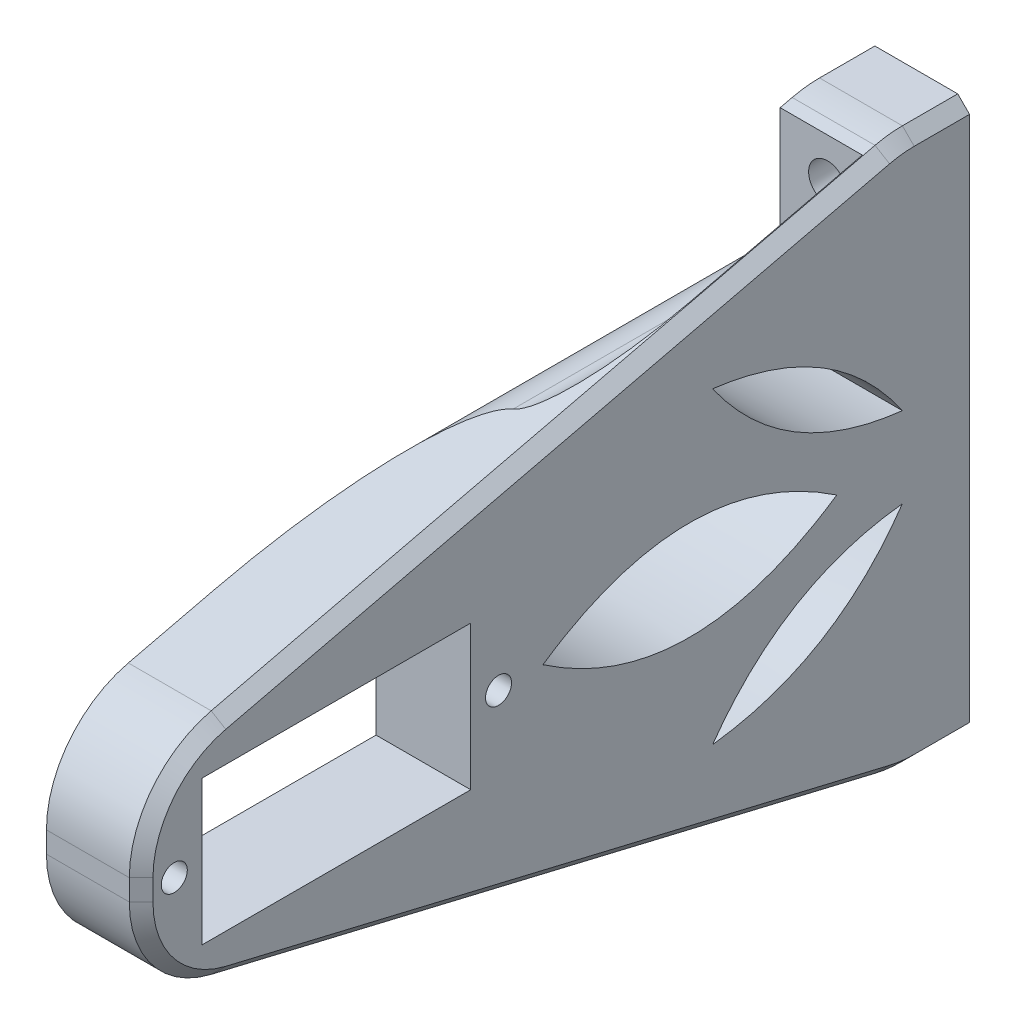
from build123d import *

# Parameters (mm, degrees)
SKETCH1_W           = 8.000974829
SKETCH1_H           = 46.5
BOSS_EXTRUDE1_DEPTH = 70
CUT_EXTRUDE1_DEPTH  = 70
SKETCH3_R           = 1.1
CUT_EXTRUDE2_DEPTH  = 70
FILLET1_R           = 9
CUT_EXTRUDE3_DEPTH  = 62
SKETCH5_R           = 1.6
CUT_EXTRUDE4_DEPTH  = 62
FILLET2_R           = 5
CHAMFER1_SIZE       = 1


with BuildPart() as part:
    # Sketch1 → Boss-Extrude1 (new body)
    with BuildSketch(Plane.XY):
        with Locations((34.458782271, 0)):
            Rectangle(SKETCH1_W, SKETCH1_H)
    extrude(amount=BOSS_EXTRUDE1_DEPTH)

    # Sketch2 → Cut-Extrude1 (cut)
    with BuildSketch(Plane(origin=(38.459269685, 0, 0), x_dir=(0, 0, -1), z_dir=(1, 0, 0))):
        with BuildLine():
            Line((0, -23.25), (-4.675968949, -23.25))
            ThreePointArc((-4.675968949, -23.25), (-5.84025075, -23.181991134), (-6.988696254, -22.978889578))
            Line((-6.988696254, -22.978889578), (-70, -8))
            Line((-70, -8), (-70, 0))
            Line((-70, 0), (-70, 8))
            Line((-70, 8), (-6.988696254, 22.978889578))
            ThreePointArc((-6.988696254, 22.978889578), (-5.84025075, 23.181991134), (-4.675968949, 23.25))
            Line((-4.675968949, 23.25), (0, 23.25))
            Line((0, 23.25), (0, 33.462731107))
            Line((0, 33.462731107), (-74.824697051, 33.462731107))
            Line((-74.824697051, 33.462731107), (-74.824697051, -41.354226456))
            Line((-74.824697051, -41.354226456), (0, -41.354226456))
            Line((0, -41.354226456), (0, -23.25))
        make_face()
        with BuildLine():
            add(Edge.make_bspline(
                [(-36.048150351, 0), (-23.713645553, -8.388071288), (-11.218940507, 0)],
                knots=[0, 0, 0, 1, 1, 1], degree=2))
            add(Edge.make_bspline(
                [(-36.048150351, 0), (-23.713645553, 8.388071288), (-11.218940507, 0)],
                knots=[0, 0, 0, 1, 1, 1], degree=2))
        make_face()
        with BuildLine():
            add(Edge.make_bspline(
                [(-5.680368735, 3.40627966), (-15.724909711, 4.511710031), (-21.714178832, 13.021085274)],
                knots=[0, 0, 0, 1, 1, 1], degree=2))
            add(Edge.make_bspline(
                [(-5.680368735, 3.40627966), (-11.386784663, 11.746039667), (-21.714178832, 13.021085274)],
                knots=[0, 0, 0, 1, 1, 1], degree=2))
        make_face()
        with BuildLine():
            add(Edge.make_bspline(
                [(-5.680368735, -3.40627966), (-15.724909711, -4.511710031), (-21.714178832, -13.021085274)],
                knots=[0, 0, 0, 1, 1, 1], degree=2))
            add(Edge.make_bspline(
                [(-5.680368735, -3.40627966), (-11.386784663, -11.746039667), (-21.714178832, -13.021085274)],
                knots=[0, 0, 0, 1, 1, 1], degree=2))
        make_face()
    extrude(amount=-CUT_EXTRUDE1_DEPTH, mode=Mode.SUBTRACT)

    # Sketch3 → Cut-Extrude2 (cut)
    with BuildSketch(Plane.ZY.offset(-30.458294856)):
        with Locations((67.2, 0)):
            Circle(SKETCH3_R)
        with Locations(Location((39.8, 0, 0), (0, 0, 270))):
            Circle(SKETCH3_R)
        Polygon((53.5, 6.1), (42.15, 6.1), (42.15, -6.1), (64.85, -6.1), (64.85, 6.1), align=None)
    extrude(amount=-CUT_EXTRUDE2_DEPTH, mode=Mode.SUBTRACT)

    # Fillet1
    fillet1_edges = [part.edges().sort_by_distance(p)[0] for p in [
        (34.458782271, -8, 70),
        (34.458782271, 8, 70),
    ]]
    fillet(fillet1_edges, radius=FILLET1_R)

    # Sketch4 → Cut-Extrude3 (cut)
    with BuildSketch(Plane.XY.offset(70)):
        with BuildLine():
            ThreePointArc((37.397007822, -19.25), (36.536421482, -17.172360788), (34.458782271, -16.311774449))
            Line((34.458782271, -16.311774449), (30.458294856, -16.311774449))
            Line((30.458294856, -16.311774449), (30.458294856, -22.188225551))
            Line((30.458294856, -22.188225551), (30.458294856, -24.738187672))
            Line((30.458294856, -24.738187672), (37.397007822, -23.25))
            Line((37.397007822, -23.25), (37.397007822, -19.25))
        make_face()
        with BuildLine():
            Line((30.458294856, 24.500594278), (30.458294856, 22.188225551))
            Line((30.458294856, 22.188225551), (30.458294856, 16.311774449))
            Line((30.458294856, 16.311774449), (34.458782271, 16.311774449))
            ThreePointArc((34.458782271, 16.311774449), (36.536421482, 17.172360788), (37.397007822, 19.25))
            Line((37.397007822, 19.25), (37.397007822, 23.25))
            Line((37.397007822, 23.25), (30.458294856, 24.500594278))
        make_face()
    extrude(amount=-CUT_EXTRUDE3_DEPTH, mode=Mode.SUBTRACT)

    # Sketch5 → Cut-Extrude4 (cut)
    with BuildSketch(Plane.XY.offset(8)):
        with Locations((34.458782271, 19.25)):
            Circle(SKETCH5_R)
        with Locations((34.458782271, -19.25)):
            Circle(SKETCH5_R)
    extrude(amount=-CUT_EXTRUDE4_DEPTH, mode=Mode.SUBTRACT)

    # Fillet2
    # the kernel refuses this fillet: 5 mm, written as the material it takes off along each edge
    with BuildSketch(Plane(origin=(30.458294856, -16.311774449, 56.016575811), x_dir=(0, 1, 0), z_dir=(0, 0, -1))) as fillet2_piece_1:
        with BuildLine():
            CenterArc((4.936823623, 5), FILLET2_R, 187.233387323, 82.766612677)
            Line((-0.023383871, 4.37044332), (-0.519404621, 4.307487652))
            ThreePointArc((-0.519404621, 4.307487652), (-0.5, 4.000487415), (-0.5, 0))
            Line((-0.5, 0), (0, -0.5))
            Line((0, -0.5), (4.936823623, -0.5))
            Line((4.936823623, -0.5), (4.936823623, 0))
        make_face()
    extrude(amount=48.016575811, mode=Mode.SUBTRACT)
    with BuildSketch(Plane(origin=(30.458294856, 16.311774449, 56.016575811), x_dir=(0, -1, 0), z_dir=(0, 0, -1))) as fillet2_piece_2:
        with BuildLine():
            CenterArc((4.936823623, -5), FILLET2_R, 90, 82.766612677)
            Line((-0.023383871, -4.37044332), (-0.519404621, -4.307487652))
            ThreePointArc((-0.519404621, -4.307487652), (-0.5, -4.000487415), (-0.5, 0))
            Line((-0.5, 0), (0, 0.5))
            Line((0, 0.5), (4.936823623, 0.5))
            Line((4.936823623, 0.5), (4.936823623, 0))
        make_face()
    extrude(amount=48.016575811, mode=Mode.SUBTRACT)

    # Chamfer1
    chamfer1_edges = [part.edges().sort_by_distance(p)[0] for p in [
        (38.459269685, 16.311774449, 35.035075414),
        (38.459269685, 0, 70),
        (38.459269685, -6.468394753, 68.061624854),
        (38.459269685, 6.468394753, 68.061624854),
        (38.459269685, 23.25, 2.337984474),
        (38.459269685, -23.25, 2.337984474),
        (38.459269685, -23.181991134, 5.84025075),
        (38.459269685, -16.311774449, 35.035075414),
        (38.459269685, 23.181991134, 5.84025075),
    ]]
    chamfer(chamfer1_edges, length=CHAMFER1_SIZE)


solid = part.part
